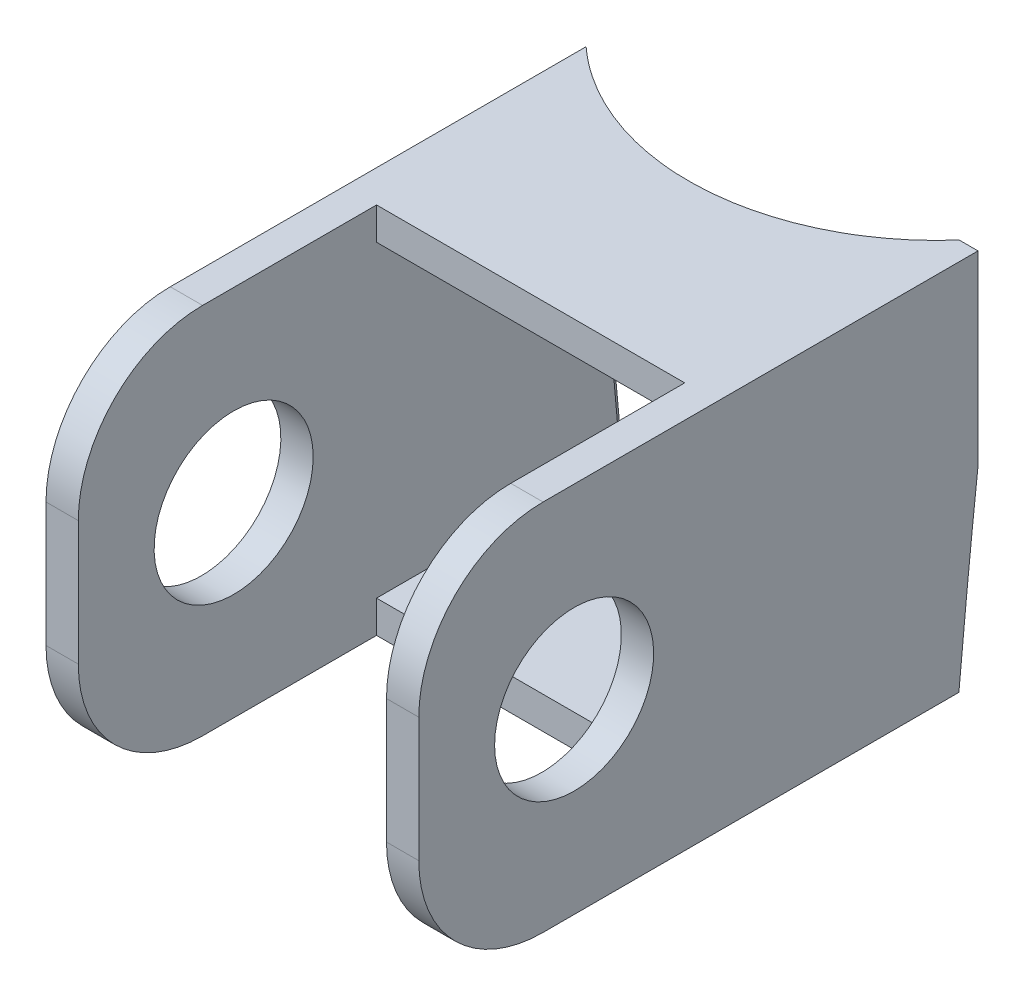
from build123d import *

# Parameters (mm, degrees)
SKETCH1_W               = 19.05
SKETCH1_H               = 19.05
SKETCH1_W_2             = 15.748
SKETCH1_H_2             = 15.748
BOSS_EXTRUDE1_DEPTH     = 28.575
CUT_EXTRUDE2_DEPTH      = 36.639286609
CUT_EXTRUDE2_DEPTH_BACK = 36.639286609
SKETCH3_R               = 4.064
CUT_EXTRUDE4_DEPTH      = 36.639286609
CUT_EXTRUDE4_DEPTH_BACK = 36.639286609
SKETCH4_W               = 15.748
SKETCH4_H               = 15.24
FILLET2_R               = 6.35
CUT_EXTRUDE5_START      = -10.431366523
CUT_EXTRUDE5_DEPTH      = 20.862732946


# Read off the part's stored shape, not the designer's step: Cut-Extrude5
with BuildPart() as part:
    # Sketch1 → Boss-Extrude1 (new body)
    with BuildSketch(Plane.XY):
        Rectangle(SKETCH1_W, SKETCH1_H)
        Rectangle(SKETCH1_W_2, SKETCH1_H_2, mode=Mode.SUBTRACT)
    extrude(amount=BOSS_EXTRUDE1_DEPTH)

    # Sketch3 → Cut-Extrude2 (cut, two sides: drawn at the far end of the back side and taken through both)
    with BuildSketch(Plane(origin=(9.525, 0, 0), x_dir=(0, 0, -1), z_dir=(1, 0, 0)).offset(-CUT_EXTRUDE2_DEPTH_BACK)):
        with Locations(Location((-20.6375, 0, 0), (0, 0, 90))):
            Circle(SKETCH3_R)
    extrude(amount=CUT_EXTRUDE2_DEPTH + CUT_EXTRUDE2_DEPTH_BACK, mode=Mode.SUBTRACT)

    # Sketch4 → Cut-Extrude4 (cut, two sides: drawn at the far end of the back side and taken through both)
    with BuildSketch(Plane.XZ.offset(9.525).offset(-CUT_EXTRUDE4_DEPTH_BACK)):
        with Locations((0, 20.955)):
            Rectangle(SKETCH4_W, SKETCH4_H)
    extrude(amount=CUT_EXTRUDE4_DEPTH + CUT_EXTRUDE4_DEPTH_BACK, mode=Mode.SUBTRACT)

    # Fillet2
    fillet2_edges = [part.edges().sort_by_distance(p)[0] for p in [
        (-8.6995, -9.525, 28.575),
        (8.6995, -9.525, 28.575),
        (-8.6995, 9.525, 28.575),
        (8.6995, 9.525, 28.575),
    ]]
    fillet(fillet2_edges, radius=FILLET2_R)

    # Cut-Extrude5 outline → Cut-Extrude5 (cut)
    with BuildSketch(Plane(origin=(0, 0, 0), x_dir=(0.9949685182509123, 0.10018806161207, 0), z_dir=(0.10018806161207001, -0.9949685182509123, 0)).offset(CUT_EXTRUDE5_START)):
        with BuildLine():
            add(Edge.make_bspline(
                [(-9.477075136, 0), (0, 10.800334816), (9.477075136, 0)],
                knots=[5.435123228, 5.435123228, 5.435123228, 7.131247386, 7.131247386, 7.131247386], degree=2, weights=[1, 0.661437828, 1]))
            Line((-9.477075136, 0), (9.477075136, 0))
        make_face()
    extrude(amount=CUT_EXTRUDE5_DEPTH, mode=Mode.SUBTRACT)


solid = part.part
